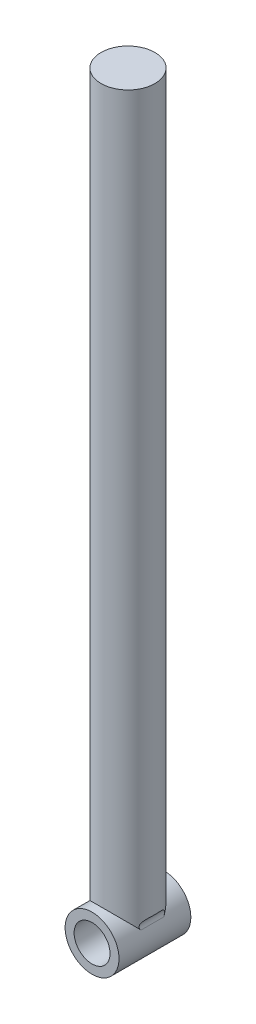
from build123d import *

# Parameters (mm, degrees)
SKETCH1_R           = 37.5
SKETCH1_R_2         = 25
BOSS_EXTRUDE1_DEPTH = 100
BOSS_EXTRUDE2_START = 30
SKETCH2_R           = 37.5
BOSS_EXTRUDE2_DEPTH = 1000
FILLET1_R           = 10


with BuildPart() as part:
    # Sketch1 → Boss-Extrude1 (new body)
    with BuildSketch(Plane.XY):
        Circle(SKETCH1_R)
        Circle(SKETCH1_R_2, mode=Mode.SUBTRACT)
    extrude(amount=BOSS_EXTRUDE1_DEPTH)

    # Sketch2 → Boss-Extrude2 (add)
    with BuildSketch(Plane(origin=(0, 0, 0), x_dir=(1, 0, 0), z_dir=(0, 1, 0)).offset(BOSS_EXTRUDE2_START)):
        with Locations(Location((0, -50, 0), (0, 0, 53.130102354))):
            Circle(SKETCH2_R)
    extrude(amount=BOSS_EXTRUDE2_DEPTH)

    # Fillet1
    # the kernel refuses this fillet: 10 mm, written as the material it adds along each edge
    with BuildSketch(Plane(origin=(22.5, 30, 131.460549623), x_dir=(0.6295317231300945, -0.7769747805256321, 0), z_dir=(0, 0, -1))) as fillet1_piece_1_section:
        with BuildLine():
            CenterArc((20.728167196, -9.698102468), FILLET1_R, 104.114519992, 114.90106237)
            Line((12.958419391, -15.993419699), (0, 0))
            ThreePointArc((0, 0), (9.144779645, -1.132115744), (18.289559291, 0))
        make_face()
    fillet1_piece_1 = extrude(amount=162.921099245, mode=Mode.PRIVATE)
    fillet1_piece_1 = fillet1_piece_1 & Plane(origin=(0, 26.517376083, 50), x_dir=(0.6000000000021779, 0, -0.7999999999983666), z_dir=(0, -1, 0)) * Cylinder(37.5, 400, mode=Mode.PRIVATE)
    add(fillet1_piece_1)
    with BuildSketch(Plane(origin=(-22.5, 30, 131.460549623), x_dir=(-0.6295317231300945, -0.7769747805256321, 0), z_dir=(0, 0, -1))) as fillet1_piece_2_section:
        with BuildLine():
            CenterArc((20.728167196, 9.698102468), FILLET1_R, 140.984417638, 114.90106237)
            Line((12.958419391, 15.993419699), (0, 0))
            ThreePointArc((0, 0), (9.144779645, 1.132115744), (18.289559291, 0))
        make_face()
    fillet1_piece_2 = extrude(amount=162.921099245, mode=Mode.PRIVATE)
    fillet1_piece_2 = fillet1_piece_2 & Plane(origin=(0, 26.517339573, 50), x_dir=(0.6000000000021779, 0, -0.7999999999983666), z_dir=(0, -1, 0)) * Cylinder(37.5, 400, mode=Mode.PRIVATE)
    add(fillet1_piece_2)


solid = part.part
